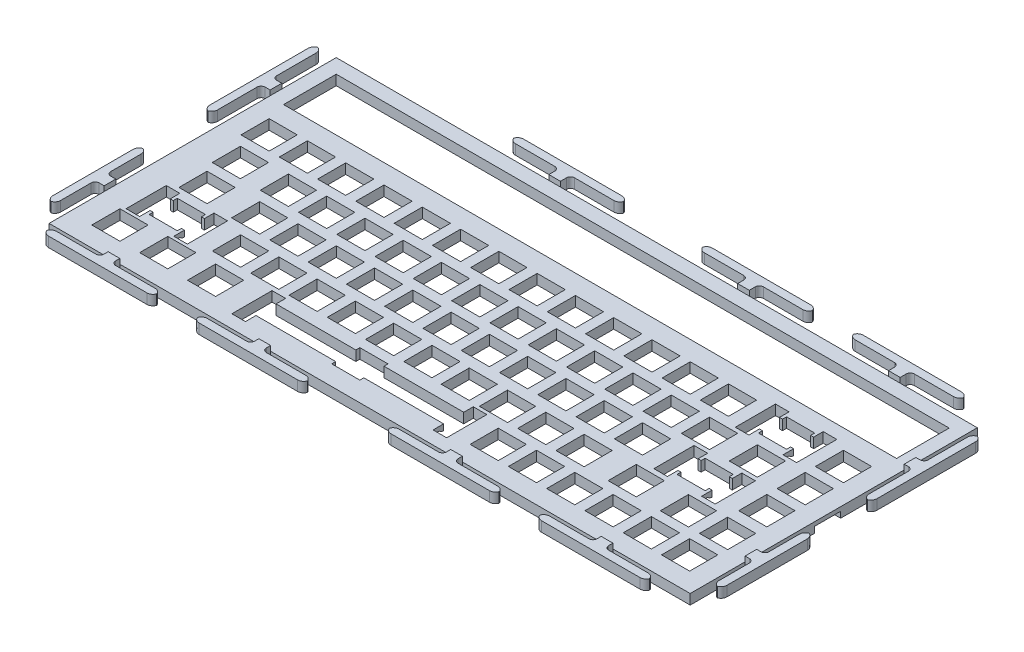
from build123d import *

# Parameters (mm, degrees)
SKETCH1_W           = 319
SKETCH1_H           = 142.875
SKETCH1_W_2         = 14
SKETCH1_H_2         = 14
SKETCH1_W_3         = 305
SKETCH1_H_3         = 26.2
BOSS_EXTRUDE2_DEPTH = 2.5
BOSS_EXTRUDE3_DEPTH = 2.5
SKETCH3_W           = 6.5
SKETCH3_H           = 13
SKETCH3_W_2         = 11.999287304
SKETCH3_H_2         = 5.5
SKETCH3_W_3         = 7
CUT_EXTRUDE1_DEPTH  = 246.814043286
CUT_EXTRUDE2_DEPTH  = 18
CUT_EXTRUDE3_DEPTH  = 18
CUT_EXTRUDE4_DEPTH  = 18
CUT_EXTRUDE5_DEPTH  = 95
FILLET1_R           = 2
FILLET2_R           = 3
FILLET3_R           = 3
SKETCH10_W          = 7
SKETCH10_H          = 13
SKETCH10_W_2        = 11.999287304
SKETCH10_H_2        = 5.5
SKETCH10_W_3        = 6.5
BOSS_EXTRUDE4_DEPTH = 2


with BuildPart() as part:
    # Sketch1 → Boss-Extrude2 (new, symmetric)
    with BuildSketch(Plane(origin=(0, 0, 0), x_dir=(1, 0, 0), z_dir=(0, 1, 0))):
        with Locations((55.078496059, 23.552072889)):
            Rectangle(SKETCH1_W, SKETCH1_H)
        with Locations((-68.754503941, 44.995572889)):
            Rectangle(SKETCH1_W_2, SKETCH1_H_2, mode=Mode.SUBTRACT)
        with Locations((-87.826503941, 44.995572889)):
            Rectangle(SKETCH1_W_2, SKETCH1_H_2, mode=Mode.SUBTRACT)
        with Locations((140.749496059, 44.995572889)):
            Rectangle(SKETCH1_W_2, SKETCH1_H_2, mode=Mode.SUBTRACT)
        with Locations((-30.654503941, 44.995572889)):
            Rectangle(SKETCH1_W_2, SKETCH1_H_2, mode=Mode.SUBTRACT)
        with Locations((-49.704503941, 44.995572889)):
            Rectangle(SKETCH1_W_2, SKETCH1_H_2, mode=Mode.SUBTRACT)
        with Locations((7.445496059, 44.995572889)):
            Rectangle(SKETCH1_W_2, SKETCH1_H_2, mode=Mode.SUBTRACT)
        with Locations((-11.604503941, 44.995572889)):
            Rectangle(SKETCH1_W_2, SKETCH1_H_2, mode=Mode.SUBTRACT)
        with Locations((45.545496059, 44.995572889)):
            Rectangle(SKETCH1_W_2, SKETCH1_H_2, mode=Mode.SUBTRACT)
        with Locations((26.495496059, 44.995572889)):
            Rectangle(SKETCH1_W_2, SKETCH1_H_2, mode=Mode.SUBTRACT)
        with Locations((174.183496059, 25.945572889)):
            Rectangle(SKETCH1_W_2, SKETCH1_H_2, mode=Mode.SUBTRACT)
        with Locations((83.645496059, 44.995572889)):
            Rectangle(SKETCH1_W_2, SKETCH1_H_2, mode=Mode.SUBTRACT)
        with Locations((64.595496059, 44.995572889)):
            Rectangle(SKETCH1_W_2, SKETCH1_H_2, mode=Mode.SUBTRACT)
        with Locations((121.722496059, 44.995572889)):
            Rectangle(SKETCH1_W_2, SKETCH1_H_2, mode=Mode.SUBTRACT)
        with Locations((102.695496059, 44.995572889)):
            Rectangle(SKETCH1_W_2, SKETCH1_H_2, mode=Mode.SUBTRACT)
        Polygon((162.399496059, 52.245572889), (176.399496059, 52.245572889), (176.399496059, 50.245572889), (177.899496059, 50.245572889), (177.899496059, 54.995572889), (184.649496059, 54.995572889), (184.649496059, 34.995572889), (177.899496059, 34.995572889), (177.899496059, 40.245572889), (176.399496059, 40.245572889), (176.399496059, 38.245572889), (162.399496059, 38.245572889), (162.399496059, 40.245572889), (160.899496059, 40.245572889), (160.899496059, 34.995572889), (154.149496059, 34.995572889), (154.149496059, 54.995572889), (160.899496059, 54.995572889), (160.899496059, 50.245572889), (162.399496059, 50.245572889), align=None, mode=Mode.SUBTRACT)
        with Locations((-40.126503941, 25.945572889)):
            Rectangle(SKETCH1_W_2, SKETCH1_H_2, mode=Mode.SUBTRACT)
        with Locations((-59.176503941, 25.945572889)):
            Rectangle(SKETCH1_W_2, SKETCH1_H_2, mode=Mode.SUBTRACT)
        with Locations((-2.051503941, 25.945572889)):
            Rectangle(SKETCH1_W_2, SKETCH1_H_2, mode=Mode.SUBTRACT)
        with Locations((-21.076503941, 25.945572889)):
            Rectangle(SKETCH1_W_2, SKETCH1_H_2, mode=Mode.SUBTRACT)
        with Locations((36.073496059, 25.945572889)):
            Rectangle(SKETCH1_W_2, SKETCH1_H_2, mode=Mode.SUBTRACT)
        with Locations((16.948496059, 25.945572889)):
            Rectangle(SKETCH1_W_2, SKETCH1_H_2, mode=Mode.SUBTRACT)
        with Locations((74.148496059, 25.945572889)):
            Rectangle(SKETCH1_W_2, SKETCH1_H_2, mode=Mode.SUBTRACT)
        with Locations((55.123496059, 25.945572889)):
            Rectangle(SKETCH1_W_2, SKETCH1_H_2, mode=Mode.SUBTRACT)
        Polygon((159.986496059, 14.145572889), (173.986496059, 14.145572889), (173.986496059, 12.145572889), (175.486496059, 12.145572889), (175.486496059, 16.895572889), (182.236496059, 16.895572889), (182.236496059, -3.104427111), (175.486496059, -3.104427111), (175.486496059, 2.145572889), (173.986496059, 2.145572889), (173.986496059, 0.145572889), (159.986496059, 0.145572889), (159.986496059, 2.145572889), (158.486496059, 2.145572889), (158.486496059, -3.104427111), (151.736496059, -3.104427111), (151.736496059, 16.895572889), (158.486496059, 16.895572889), (158.486496059, 12.145572889), (159.986496059, 12.145572889), align=None, mode=Mode.SUBTRACT)
        with Locations((-35.363503941, 6.895572889)):
            Rectangle(SKETCH1_W_2, SKETCH1_H_2, mode=Mode.SUBTRACT)
        with Locations((-54.413503941, 6.895572889)):
            Rectangle(SKETCH1_W_2, SKETCH1_H_2, mode=Mode.SUBTRACT)
        with Locations((112.273496059, 25.945572889)):
            Rectangle(SKETCH1_W_2, SKETCH1_H_2, mode=Mode.SUBTRACT)
        with Locations((93.223496059, 25.945572889)):
            Rectangle(SKETCH1_W_2, SKETCH1_H_2, mode=Mode.SUBTRACT)
        with Locations((-83.063503941, 25.945572889)):
            Rectangle(SKETCH1_W_2, SKETCH1_H_2, mode=Mode.SUBTRACT)
        with Locations((131.323496059, 25.945572889)):
            Rectangle(SKETCH1_W_2, SKETCH1_H_2, mode=Mode.SUBTRACT)
        with Locations((150.373496059, 25.945572889)):
            Rectangle(SKETCH1_W_2, SKETCH1_H_2, mode=Mode.SUBTRACT)
        with Locations((2.736496059, 6.895572889)):
            Rectangle(SKETCH1_W_2, SKETCH1_H_2, mode=Mode.SUBTRACT)
        with Locations((-16.313503941, 6.895572889)):
            Rectangle(SKETCH1_W_2, SKETCH1_H_2, mode=Mode.SUBTRACT)
        with Locations((40.836496059, 6.895572889)):
            Rectangle(SKETCH1_W_2, SKETCH1_H_2, mode=Mode.SUBTRACT)
        with Locations((21.786496059, 6.895572889)):
            Rectangle(SKETCH1_W_2, SKETCH1_H_2, mode=Mode.SUBTRACT)
        with Locations((78.936496059, 6.895572889)):
            Rectangle(SKETCH1_W_2, SKETCH1_H_2, mode=Mode.SUBTRACT)
        with Locations((59.886496059, 6.895572889)):
            Rectangle(SKETCH1_W_2, SKETCH1_H_2, mode=Mode.SUBTRACT)
        with Locations((117.036496059, 6.895572889)):
            Rectangle(SKETCH1_W_2, SKETCH1_H_2, mode=Mode.SUBTRACT)
        with Locations((97.986496059, 6.895572889)):
            Rectangle(SKETCH1_W_2, SKETCH1_H_2, mode=Mode.SUBTRACT)
        with Locations((-80.607503941, 6.895572889)):
            Rectangle(SKETCH1_W_2, SKETCH1_H_2, mode=Mode.SUBTRACT)
        with Locations((136.086496059, 6.895572889)):
            Rectangle(SKETCH1_W_2, SKETCH1_H_2, mode=Mode.SUBTRACT)
        with Locations((-25.838503941, -12.154427111)):
            Rectangle(SKETCH1_W_2, SKETCH1_H_2, mode=Mode.SUBTRACT)
        with Locations((-44.888503941, -12.154427111)):
            Rectangle(SKETCH1_W_2, SKETCH1_H_2, mode=Mode.SUBTRACT)
        with Locations((12.261496059, -12.154427111)):
            Rectangle(SKETCH1_W_2, SKETCH1_H_2, mode=Mode.SUBTRACT)
        with Locations((-6.788503941, -12.154427111)):
            Rectangle(SKETCH1_W_2, SKETCH1_H_2, mode=Mode.SUBTRACT)
        with Locations((50.361496059, -12.154427111)):
            Rectangle(SKETCH1_W_2, SKETCH1_H_2, mode=Mode.SUBTRACT)
        with Locations((31.311496059, -12.154427111)):
            Rectangle(SKETCH1_W_2, SKETCH1_H_2, mode=Mode.SUBTRACT)
        with Locations((88.461496059, -12.654427111)):
            Rectangle(SKETCH1_W_2, SKETCH1_H_2, mode=Mode.SUBTRACT)
        with Locations((69.411496059, -12.654427111)):
            Rectangle(SKETCH1_W_2, SKETCH1_H_2, mode=Mode.SUBTRACT)
        with Locations((126.561496059, -12.654427111)):
            Rectangle(SKETCH1_W_2, SKETCH1_H_2, mode=Mode.SUBTRACT)
        with Locations((107.511496059, -12.654427111)):
            Rectangle(SKETCH1_W_2, SKETCH1_H_2, mode=Mode.SUBTRACT)
        Polygon((-83.344503941, -5.154427111), (-69.344503941, -5.154427111), (-69.344503941, -7.154427111), (-67.844503941, -7.154427111), (-67.844503941, -2.404427111), (-61.094503941, -2.404427111), (-61.094503941, -22.404427111), (-67.844503941, -22.404427111), (-67.844503941, -17.154427111), (-69.344503941, -17.154427111), (-69.344503941, -19.154427111), (-83.344503941, -19.154427111), (-83.344503941, -17.154427111), (-84.844503941, -17.154427111), (-84.844503941, -22.404427111), (-91.594503941, -22.404427111), (-91.594503941, -2.404427111), (-84.844503941, -2.404427111), (-84.844503941, -7.154427111), (-83.344503941, -7.154427111), align=None, mode=Mode.SUBTRACT)
        with Locations((152.523496059, -12.654427111)):
            Rectangle(SKETCH1_W_2, SKETCH1_H_2, mode=Mode.SUBTRACT)
        with Locations((178.485496059, -12.654427111)):
            Rectangle(SKETCH1_W_2, SKETCH1_H_2, mode=Mode.SUBTRACT)
        with Locations((55.223496059, 74.745572889)):
            Rectangle(SKETCH1_W_3, SKETCH1_H_3, mode=Mode.SUBTRACT)
        with Locations((197.995496059, 25.945572889)):
            Rectangle(SKETCH1_W_2, SKETCH1_H_2, mode=Mode.SUBTRACT)
        with Locations((197.974496059, 44.995572889)):
            Rectangle(SKETCH1_W_2, SKETCH1_H_2, mode=Mode.SUBTRACT)
        with Locations((197.942496059, 6.895572889)):
            Rectangle(SKETCH1_W_2, SKETCH1_H_2, mode=Mode.SUBTRACT)
        with Locations((197.985496059, -12.654427111)):
            Rectangle(SKETCH1_W_2, SKETCH1_H_2, mode=Mode.SUBTRACT)
        with Locations((-86.094503941, -30.954427111)):
            Rectangle(SKETCH1_W_2, SKETCH1_H_2, mode=Mode.SUBTRACT)
        with Locations((-62.294503941, -30.954427111)):
            Rectangle(SKETCH1_W_2, SKETCH1_H_2, mode=Mode.SUBTRACT)
        with Locations((-38.494503941, -30.954427111)):
            Rectangle(SKETCH1_W_2, SKETCH1_H_2, mode=Mode.SUBTRACT)
        Polygon((26.439496059, -24.114427111), (40.439496059, -24.114427111), (40.439496059, -26.114427111), (80.123496059, -26.114427111), (80.123496059, -21.364427111), (86.873496059, -21.364427111), (86.873496059, -41.364427111), (80.123496059, -41.364427111), (80.123496059, -36.114427111), (40.439496059, -36.114427111), (40.439496059, -38.114427111), (26.439496059, -38.114427111), (26.439496059, -36.114427111), (-13.244503941, -36.114427111), (-13.244503941, -41.364427111), (-19.994503941, -41.364427111), (-19.994503941, -21.364427111), (-13.244503941, -21.364427111), (-13.244503941, -26.114427111), (26.439496059, -26.114427111), align=None, mode=Mode.SUBTRACT)
        with Locations((102.543496059, -31.364427111)):
            Rectangle(SKETCH1_W_2, SKETCH1_H_2, mode=Mode.SUBTRACT)
        with Locations((121.593496059, -31.364427111)):
            Rectangle(SKETCH1_W_2, SKETCH1_H_2, mode=Mode.SUBTRACT)
        with Locations((140.643496059, -31.364427111)):
            Rectangle(SKETCH1_W_2, SKETCH1_H_2, mode=Mode.SUBTRACT)
        with Locations((159.693496059, -31.364427111)):
            Rectangle(SKETCH1_W_2, SKETCH1_H_2, mode=Mode.SUBTRACT)
        with Locations((178.743496059, -31.364427111)):
            Rectangle(SKETCH1_W_2, SKETCH1_H_2, mode=Mode.SUBTRACT)
        with Locations((197.793496059, -31.364427111)):
            Rectangle(SKETCH1_W_2, SKETCH1_H_2, mode=Mode.SUBTRACT)
    extrude(amount=BOSS_EXTRUDE2_DEPTH, both=True)

    # Sketch2 → Boss-Extrude3 (add, symmetric)
    with BuildSketch(Plane(origin=(0, 2.5, 0), x_dir=(1, 0, 0), z_dir=(0, 1, 0))):
        Polygon((214.578496059, 64.389572889), (214.578496059, 58.589572889), (218.678496059, 58.589572889), (218.678496059, 33.989572889), (222.678496059, 33.989572889), (222.678496059, 88.989572889), (218.678496059, 88.989572889), (218.678496059, 64.389572889), align=None)
        Polygon((-104.421503941, 67.889572889), (-104.421503941, 62.089572889), (-108.921503941, 62.089572889), (-108.921503941, 37.489572889), (-112.921503941, 37.489572889), (-112.921503941, 92.489572889), (-108.921503941, 92.489572889), (-108.921503941, 67.889572889), align=None)
        Polygon((-104.421503941, -14.685427111), (-104.421503941, -20.485427111), (-108.921503941, -20.485427111), (-108.921503941, -40.585427111), (-112.921503941, -40.585427111), (-112.921503941, 5.414572889), (-108.921503941, 5.414572889), (-108.921503941, -14.685427111), align=None)
        Polygon((1.358496059, 94.989572889), (7.158496059, 94.989572889), (7.158496059, 99.989572889), (31.758496059, 99.989572889), (31.758496059, 103.989572889), (-23.241503941, 103.989572889), (-23.241503941, 99.989572889), (1.358496059, 99.989572889), align=None)
        Polygon((-75.021503941, -47.885427111), (-69.221503941, -47.885427111), (-69.221503941, -51.985427111), (-44.621503941, -51.985427111), (-44.621503941, -55.985427111), (-99.621503941, -55.985427111), (-99.621503941, -51.985427111), (-75.021503941, -51.985427111), align=None)
        Polygon((-0.021503941, -47.885427111), (5.778496059, -47.885427111), (5.778496059, -51.985427111), (30.378496059, -51.985427111), (30.378496059, -55.985427111), (-24.621503941, -55.985427111), (-24.621503941, -51.985427111), (-0.021503941, -51.985427111), align=None)
        Polygon((95.428496059, -47.885427111), (101.228496059, -47.885427111), (101.228496059, -51.985427111), (125.828496059, -51.985427111), (125.828496059, -55.985427111), (70.828496059, -55.985427111), (70.828496059, -51.985427111), (95.428496059, -51.985427111), align=None)
        Polygon((170.328496059, -47.885427111), (176.128496059, -47.885427111), (176.128496059, -51.985427111), (200.728496059, -51.985427111), (200.728496059, -55.985427111), (145.728496059, -55.985427111), (145.728496059, -51.985427111), (170.328496059, -51.985427111), align=None)
        Polygon((95.314498579, 94.989572889), (101.114498579, 94.989572889), (101.114498579, 99.989572889), (125.714498579, 99.989572889), (125.714498579, 103.989572889), (70.714498579, 103.989572889), (70.714498579, 99.989572889), (95.314498579, 99.989572889), align=None)
        Polygon((170.396631751, 94.989572889), (176.196631751, 94.989572889), (176.196631751, 99.989572889), (200.796631751, 99.989572889), (200.796631751, 103.989572889), (145.796631751, 103.989572889), (145.796631751, 99.989572889), (170.396631751, 99.989572889), align=None)
        Polygon((214.578496059, -14.785427111), (214.578496059, -20.585427111), (218.678496059, -20.585427111), (218.678496059, -40.685427111), (222.678496059, -40.685427111), (222.678496059, 5.314572889), (218.678496059, 5.314572889), (218.678496059, -14.785427111), align=None)
    extrude(amount=BOSS_EXTRUDE3_DEPTH, both=True)

    # Sketch3 → Cut-Extrude1 (cut, through all)
    with BuildSketch(Plane(origin=(0, 2.5, 0), x_dir=(1, 0, 0), z_dir=(0, 1, 0))):
        with Locations((211.328496059, 20.489572889)):
            Rectangle(SKETCH3_W, SKETCH3_H)
        with Locations((52.578852407, 92.239572889)):
            Rectangle(SKETCH3_W_2, SKETCH3_H_2)
        with Locations((-100.921503941, 20.489572889)):
            Rectangle(SKETCH3_W_3, SKETCH3_H)
    extrude(amount=-CUT_EXTRUDE1_DEPTH, mode=Mode.SUBTRACT)

    # Sketch4 → Cut-Extrude2 (cut)
    with BuildSketch(Plane(origin=(175.486496059, 0, 0), x_dir=(0, 0, -1), z_dir=(1, 0, 0))):
        Polygon((-3.104427111, -2.5), (-3.104427111, 0.5), (-0.104427111, 0.5), (-0.104427111, -0.5), (2.145572889, -0.5), (2.145572889, -2.5), align=None)
    extrude(amount=-CUT_EXTRUDE2_DEPTH, mode=Mode.SUBTRACT)

    # Sketch6 → Cut-Extrude3 (cut)
    with BuildSketch(Plane(origin=(177.899496059, 0, 0), x_dir=(0, 0, -1), z_dir=(1, 0, 0))):
        Polygon((34.995572889, -2.5), (34.995572889, 0.5), (37.995572889, 0.5), (37.995572889, -0.5), (40.245572889, -0.5), (40.245572889, -2.5), align=None)
    extrude(amount=-CUT_EXTRUDE3_DEPTH, mode=Mode.SUBTRACT)

    # Sketch7 → Cut-Extrude4 (cut)
    with BuildSketch(Plane(origin=(-67.844503941, 0, 0), x_dir=(0, 0, -1), z_dir=(1, 0, 0))):
        Polygon((-22.404427111, -2.5), (-22.404427111, 0.5), (-19.404427111, 0.5), (-19.404427111, -0.5), (-17.154427111, -0.5), (-17.154427111, -2.5), align=None)
    extrude(amount=-CUT_EXTRUDE4_DEPTH, mode=Mode.SUBTRACT)

    # Sketch8 → Cut-Extrude5 (cut)
    with BuildSketch(Plane(origin=(80.123496059, 0, 0), x_dir=(0, 0, -1), z_dir=(1, 0, 0))):
        Polygon((-41.364427111, -2.5), (-41.364427111, 0.5), (-38.364427111, 0.5), (-38.364427111, -0.5), (-36.114427111, -0.5), (-36.114427111, -2.5), align=None)
    extrude(amount=-CUT_EXTRUDE5_DEPTH, mode=Mode.SUBTRACT)

    # Fillet1
    fillet1_edges = [part.edges().sort_by_distance(p)[0] for p in [
        (218.678496059, 2.5, 14.785427111),
        (218.678496059, 2.5, 20.585427111),
        (-0.021503941, 2.5, 51.985427111),
        (5.778496059, 2.5, 51.985427111),
        (95.428496059, 2.5, 51.985427111),
        (101.228496059, 2.5, 51.985427111),
        (170.328496059, 2.5, 51.985427111),
        (176.128496059, 2.5, 51.985427111),
        (-108.921503941, 2.5, 14.685427111),
        (-108.921503941, 2.5, 20.485427111),
        (1.358496059, 2.5, -99.989572889),
        (7.158496059, 2.5, -99.989572889),
        (218.678496059, 2.5, -64.389572889),
        (218.678496059, 2.5, -58.589572889),
        (-75.021503941, 2.5, 51.985427111),
        (-69.221503941, 2.5, 51.985427111),
        (95.314498579, 2.5, -99.989572889),
        (101.114498579, 2.5, -99.989572889),
        (170.396631751, 2.5, -99.989572889),
        (176.196631751, 2.5, -99.989572889),
        (-108.921503941, 2.5, -67.889572889),
        (-108.921503941, 2.5, -62.089572889),
    ]]
    fillet(fillet1_edges, radius=FILLET1_R)

    # Fillet2
    # the kernel refuses this fillet: 3 mm, written as the material it takes off along each edge
    with BuildSketch(Plane(origin=(-112.921503941, 12.5, -92.489572889), x_dir=(0, 0, 1), z_dir=(0, -1, 0)), Plane(origin=(-108.921503941, -7.5, -92.489572889), x_dir=(0, 0, 1), z_dir=(0, 1, 0)), Plane(origin=(-108.921503941, 12.5, -37.489572889), x_dir=(0, 0, -1), z_dir=(0, -1, 0)), Plane(origin=(-112.921503941, 12.5, -37.489572889), x_dir=(1, 0, 0), z_dir=(0, -1, 0)), Plane(origin=(-108.921503941, -7.5, -5.414572889), x_dir=(0, 0, 1), z_dir=(0, 1, 0)), Plane(origin=(-112.921503941, 12.5, -5.414572889), x_dir=(0, 0, 1), z_dir=(0, -1, 0)), Plane(origin=(-108.921503941, 12.5, 40.585427111), x_dir=(0, 0, -1), z_dir=(0, -1, 0)), Plane(origin=(-112.921503941, 12.5, 40.585427111), x_dir=(1, 0, 0), z_dir=(0, -1, 0)), Plane(origin=(-44.621503941, 12.5, 55.985427111), x_dir=(0, 0, -1), z_dir=(0, -1, 0)), Plane(origin=(-44.621503941, 12.5, 51.985427111), x_dir=(-1, 0, 0), z_dir=(0, -1, 0)), Plane(origin=(-99.621503941, 12.5, 55.985427111), x_dir=(1, 0, 0), z_dir=(0, -1, 0)), Plane(origin=(-99.621503941, -7.5, 51.985427111), x_dir=(1, 0, 0), z_dir=(0, 1, 0)), Plane(origin=(-24.621503941, 12.5, 55.985427111), x_dir=(1, 0, 0), z_dir=(0, -1, 0)), Plane(origin=(-24.621503941, -7.5, 51.985427111), x_dir=(1, 0, 0), z_dir=(0, 1, 0)), Plane(origin=(30.378496059, 12.5, 55.985427111), x_dir=(0, 0, -1), z_dir=(0, -1, 0)), Plane(origin=(30.378496059, 12.5, 51.985427111), x_dir=(-1, 0, 0), z_dir=(0, -1, 0)), Plane(origin=(125.828496059, 12.5, 55.985427111), x_dir=(0, 0, -1), z_dir=(0, -1, 0)), Plane(origin=(125.828496059, 12.5, 51.985427111), x_dir=(-1, 0, 0), z_dir=(0, -1, 0)), Plane(origin=(70.828496059, 12.5, 55.985427111), x_dir=(1, 0, 0), z_dir=(0, -1, 0)), Plane(origin=(70.828496059, -7.5, 51.985427111), x_dir=(1, 0, 0), z_dir=(0, 1, 0)), Plane(origin=(145.728496059, 12.5, 55.985427111), x_dir=(1, 0, 0), z_dir=(0, -1, 0)), Plane(origin=(145.728496059, -7.5, 51.985427111), x_dir=(1, 0, 0), z_dir=(0, 1, 0)), Plane(origin=(200.728496059, 12.5, 55.985427111), x_dir=(0, 0, -1), z_dir=(0, -1, 0)), Plane(origin=(200.728496059, 12.5, 51.985427111), x_dir=(-1, 0, 0), z_dir=(0, -1, 0)), Plane(origin=(222.678496059, -7.5, -5.314572889), x_dir=(0, 0, 1), z_dir=(0, 1, 0)), Plane(origin=(218.678496059, 12.5, -5.314572889), x_dir=(0, 0, 1), z_dir=(0, -1, 0)), Plane(origin=(218.678496059, -7.5, 40.685427111), x_dir=(0, 0, -1), z_dir=(0, 1, 0)), Plane(origin=(222.678496059, -7.5, 40.685427111), x_dir=(-1, 0, 0), z_dir=(0, 1, 0)), Plane(origin=(218.678496059, -7.5, -33.989572889), x_dir=(0, 0, -1), z_dir=(0, 1, 0)), Plane(origin=(222.678496059, -7.5, -33.989572889), x_dir=(-1, 0, 0), z_dir=(0, 1, 0)), Plane(origin=(222.678496059, -7.5, -88.989572889), x_dir=(0, 0, 1), z_dir=(0, 1, 0)), Plane(origin=(218.678496059, 12.5, -88.989572889), x_dir=(0, 0, 1), z_dir=(0, -1, 0)), Plane(origin=(200.796631751, -7.5, -103.989572889), x_dir=(0, 0, 1), z_dir=(0, 1, 0)), Plane(origin=(200.796631751, -7.5, -99.989572889), x_dir=(-1, 0, 0), z_dir=(0, 1, 0)), Plane(origin=(145.796631751, 12.5, -99.989572889), x_dir=(1, 0, 0), z_dir=(0, -1, 0)), Plane(origin=(145.796631751, -7.5, -103.989572889), x_dir=(1, 0, 0), z_dir=(0, 1, 0)), Plane(origin=(125.714498579, -7.5, -99.989572889), x_dir=(-1, 0, 0), z_dir=(0, 1, 0)), Plane(origin=(125.714498579, -7.5, -103.989572889), x_dir=(0, 0, 1), z_dir=(0, 1, 0)), Plane(origin=(70.714498579, 12.5, -99.989572889), x_dir=(1, 0, 0), z_dir=(0, -1, 0)), Plane(origin=(70.714498579, -7.5, -103.989572889), x_dir=(1, 0, 0), z_dir=(0, 1, 0)), Plane(origin=(31.758496059, -7.5, -99.989572889), x_dir=(-1, 0, 0), z_dir=(0, 1, 0)), Plane(origin=(31.758496059, -7.5, -103.989572889), x_dir=(0, 0, 1), z_dir=(0, 1, 0)), Plane(origin=(-23.241503941, 12.5, -99.989572889), x_dir=(1, 0, 0), z_dir=(0, -1, 0)), Plane(origin=(-23.241503941, -7.5, -103.989572889), x_dir=(1, 0, 0), z_dir=(0, 1, 0))) as fillet2_piece_1:
        with BuildLine():
            CenterArc((FILLET2_R, -FILLET2_R), FILLET2_R, 90, 90)
            Line((0, -FILLET2_R), (0, 0))
            Line((0, 0), (FILLET2_R, 0))
        make_face()
    extrude(amount=20, mode=Mode.SUBTRACT)

    # Fillet3
    # the kernel refuses this fillet: 3 mm, written as the material it takes off along each edge
    with BuildSketch(Plane(origin=(183.489666002, -0.5, -37.995572889), x_dir=(0, 1, 0), z_dir=(-1, 0, 0)), Plane(origin=(181.076666002, -0.5, 0.104427111), x_dir=(0, 1, 0), z_dir=(-1, 0, 0)), Plane(origin=(-62.254333998, -0.5, 19.404427111), x_dir=(0, 1, 0), z_dir=(-1, 0, 0))) as fillet3_piece_1:
        with BuildLine():
            CenterArc((3, 2.236067977), FILLET3_R, 180, 48.189685104)
            Line((0, 2.236067977), (-0.06, 2.236067977))
            Line((-0.06, 2.236067977), (-0.06, 0))
            Line((-0.06, 0), (0, -0.06))
            ThreePointArc((0, -0.06), (0.5, -0.06), (0.96, -0.04472136))
            Line((0.96, -0.04472136), (1, 0))
        make_face()
    extrude(amount=28.180339887, mode=Mode.SUBTRACT)
    with BuildSketch(Plane(origin=(85.713666002, -0.5, 38.364427111), x_dir=(0, 1, 0), z_dir=(-1, 0, 0))) as fillet3_piece_2:
        with BuildLine():
            CenterArc((3, 2.236067977), FILLET3_R, 180, 48.189685104)
            Line((0, 2.236067977), (-0.06, 2.236067977))
            Line((-0.06, 2.236067977), (-0.06, 0))
            Line((-0.06, 0), (0, -0.06))
            ThreePointArc((0, -0.06), (0.5, -0.06), (0.96, -0.04472136))
            Line((0.96, -0.04472136), (1, 0))
        make_face()
    extrude(amount=104.548339887, mode=Mode.SUBTRACT)

    # Sketch10 → Boss-Extrude4 (add)
    with BuildSketch(Plane(origin=(0, 2.5, 0), x_dir=(1, 0, 0), z_dir=(0, 1, 0))):
        with Locations((-100.921503941, 20.489572889)):
            Rectangle(SKETCH10_W, SKETCH10_H)
        with Locations((52.578852407, 92.239572889)):
            Rectangle(SKETCH10_W_2, SKETCH10_H_2)
        with Locations((211.328496059, 20.489572889)):
            Rectangle(SKETCH10_W_3, SKETCH10_H)
    extrude(amount=-BOSS_EXTRUDE4_DEPTH)


solid = part.part
